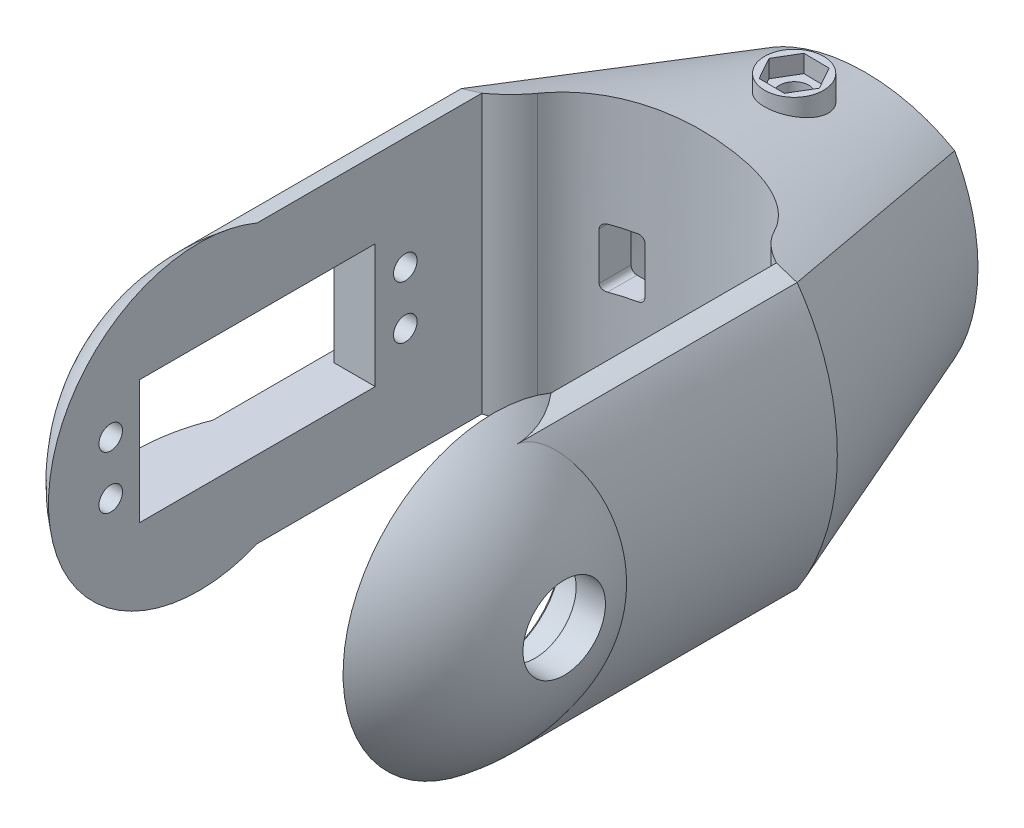
from build123d import *
from build123d.topology import SkipClean

# Parameters (mm, degrees)
BOSS_EXTRUDE3_DEPTH      = 48
CUT_EXTRUDE2_DEPTH       = 54
CUT_EXTRUDE2_DEPTH_BACK  = 57
SKETCH8_W                = 54
SKETCH8_H                = 21
CUT_EXTRUDE4_DEPTH       = 8
SKETCH24_W               = 40
SKETCH24_H               = 21
CUT_EXTRUDE13_DEPTH      = 32
BOSS_EXTRUDE4_DEPTH      = 25
BOSS_EXTRUDE4_DEPTH_BACK = 23
SKETCH21_R               = 5
CUT_EXTRUDE14_DEPTH      = 3
SKETCH26_R               = 2.5
CUT_EXTRUDE15_DEPTH      = 76
SKETCH20_R               = 15.5
CUT_EXTRUDE10_DEPTH      = 25
SKETCH22_W               = 6
SKETCH22_H               = 10
CUT_EXTRUDE12_DEPTH      = 6
FILLET1_R                = 10
CHAMFER1_SIZE            = 0.5
SKETCH27_R               = 2
CUT_EXTRUDE16_DEPTH      = 10
FILLET2_R                = 1


with BuildPart() as part:
    # Sketch1 → Loft3 section 0
    with BuildSketch(Plane.XY.offset(-10)):
        with BuildLine():
            add(Edge.make_bspline(
                [(15.25, 15.25), (6.016026936, 20.560624739), (-6.021103325, 20.458049518), (-15.25, 15.25)],
                knots=[0, 0, 0, 0, 1, 1, 1, 1], degree=3))
            add(Edge.make_bspline(
                [(-15.25, 15.25), (-20.533097965, 5.989438002), (-20.516753713, -5.985540043), (-15.25, -15.25)],
                knots=[0, 0, 0, 0, 1, 1, 1, 1], degree=3))
            add(Edge.make_bspline(
                [(15.25, -15.25), (6.016026936, -20.560624739), (-6.021103325, -20.458049518), (-15.25, -15.25)],
                knots=[0, 0, 0, 0, 1, 1, 1, 1], degree=3))
            add(Edge.make_bspline(
                [(15.25, 15.25), (20.533097965, 5.989438002), (20.516753713, -5.985540043), (15.25, -15.25)],
                knots=[0, 0, 0, 0, 1, 1, 1, 1], degree=3))
        make_face()
    # Sketch2 → Loft3 section 1
    with BuildSketch(Plane.XY.offset(30)):
        with BuildLine():
            add(Edge.make_bspline(
                [(28.5, -22.5), (10.422082605, -28.822679049), (-10.353176496, -28.500649241), (-28.5, -22.5)],
                knots=[0, 0, 0, 0, 1, 1, 1, 1], degree=3))
            add(Edge.make_bspline(
                [(-28.5, -22.5), (-37.136110342, -9.277369886), (-38.061781517, 9.268802559), (-28.5, 22.5)],
                knots=[0, 0, 0, 0, 1, 1, 1, 1], degree=3))
            add(Edge.make_bspline(
                [(28.5, 22.5), (10.422082605, 28.822679049), (-10.353176496, 28.500649241), (-28.5, 22.5)],
                knots=[0, 0, 0, 0, 1, 1, 1, 1], degree=3))
            add(Edge.make_bspline(
                [(28.5, -22.5), (37.136110342, -9.277369886), (38.061781517, 9.268802559), (28.5, 22.5)],
                knots=[0, 0, 0, 0, 1, 1, 1, 1], degree=3))
        make_face()
    loft()

    # Sketch2<4> → Boss-Extrude3 (add)
    with BuildSketch(Plane.XY.offset(30)):
        with BuildLine():
            add(Edge.make_bspline(
                [(28.5, -22.5), (10.422082605, -28.822679049), (-10.353176496, -28.500649241), (-28.5, -22.5)],
                knots=[0, 0, 0, 0, 1, 1, 1, 1], degree=3))
            add(Edge.make_bspline(
                [(-28.5, -22.5), (-37.136110342, -9.277369886), (-38.061781517, 9.268802559), (-28.5, 22.5)],
                knots=[0, 0, 0, 0, 1, 1, 1, 1], degree=3))
            add(Edge.make_bspline(
                [(28.5, 22.5), (10.422082605, 28.822679049), (-10.353176496, 28.500649241), (-28.5, 22.5)],
                knots=[0, 0, 0, 0, 1, 1, 1, 1], degree=3))
            add(Edge.make_bspline(
                [(28.5, -22.5), (37.136110342, -9.277369886), (38.061781517, 9.268802559), (28.5, 22.5)],
                knots=[0, 0, 0, 0, 1, 1, 1, 1], degree=3))
        make_face()
    extrude(amount=BOSS_EXTRUDE3_DEPTH)

    # Sketch6 → Revolve2 (revolve)
    with BuildSketch(Plane(origin=(0, 0, 0), x_dir=(1, 0, 0), z_dir=(0, 1, 0)), mode=Mode.PRIVATE) as revolve2_sk:
        with BuildLine():
            Line((-37.75, -78), (37.75, -78))
            ThreePointArc((37.75, -78), (28.377416998, -100.627416998), (5.75, -110))
            Line((5.75, -110), (-5.75, -110))
            ThreePointArc((-5.75, -110), (-28.377416998, -100.627416998), (-37.75, -78))
        make_face()
    revolve(revolve2_sk.sketch.rotate(Axis((-37.75, 0, 78), (1, 0, 0)), 180), axis=Axis((-37.75, 0, 78), (1, 0, 0)))

    # Sketch5 → Cut-Extrude2 (cut, two sides: drawn at the far end of the back side and taken through both)
    with BuildSketch(Plane(origin=(0, 0, 0), x_dir=(1, 0, 0), z_dir=(0, 1, 0)).offset(-CUT_EXTRUDE2_DEPTH_BACK)):
        with BuildLine():
            add(Edge.make_bspline(
                [(-21.5, -30), (-20.960733822, -25.817648895), (-17.137664225, -20.126916343), (-7.129529987, -18.170322639), (-1.631736919, -17.949617158), (0, -17.954481904)],
                knots=[0, 0, 0, 0, 0.183275792, 0.396096487, 0.487394954, 0.487394954, 0.487394954, 0.487394954], degree=3))
            Line((-21.5, -30), (-25, -30))
            Line((-25, -30), (-25, -121.923002988))
            Line((-25, -121.923002988), (25, -121.923002988))
            Line((25, -121.923002988), (25, -30))
            Line((25, -30), (21.5, -30))
            add(Edge.make_bspline(
                [(0, -17.954481904), (1.668937403, -17.959457557), (7.264316115, -18.228745303), (16.921403056, -19.671171349), (21.504768166, -26.768100937), (21.5, -30)],
                knots=[0.487394954, 0.487394954, 0.487394954, 0.487394954, 0.580774851, 0.804186107, 1, 1, 1, 1], degree=3))
        make_face()
    extrude(amount=CUT_EXTRUDE2_DEPTH + CUT_EXTRUDE2_DEPTH_BACK, mode=Mode.SUBTRACT)

    # Sketch8 → Cut-Extrude4 (cut)
    with BuildSketch(Plane(origin=(-40, 0, 0), x_dir=(0, 0, -1), z_dir=(1, 0, 0))):
        with Locations((-68, 0)):
            Rectangle(SKETCH8_W, SKETCH8_H)
    extrude(amount=CUT_EXTRUDE4_DEPTH, mode=Mode.SUBTRACT)

    # Sketch24 → Cut-Extrude13 (cut)
    with BuildSketch(Plane.ZY.offset(32)):
        with Locations((68.1, 0)):
            Rectangle(SKETCH24_W, SKETCH24_H)
    extrude(amount=-CUT_EXTRUDE13_DEPTH, mode=Mode.SUBTRACT)

    # Sketch21 → Boss-Extrude4 (add, two sides: drawn at the far end of the back side and taken through both)
    with BuildSketch(Plane(origin=(0, 0, 0), x_dir=(1, 0, 0), z_dir=(0, 1, 0)).offset(-BOSS_EXTRUDE4_DEPTH_BACK)):
        with Locations(Location((0, -2, 0), (0, 0, 270))):
            Circle(SKETCH21_R)
    extrude(amount=BOSS_EXTRUDE4_DEPTH + BOSS_EXTRUDE4_DEPTH_BACK)

    # Sketch25 → Cut-Extrude14 (cut)
    with BuildSketch(Plane(origin=(0, 25, 0), x_dir=(1, 0, 0), z_dir=(0, 1, 0))):
        Polygon((-2.120680215, 1.775276867), (-4.329825781, -1.948924506), (-2.209145566, -5.724201373), (2.120680215, -5.775276867), (4.329825781, -2.051075494), (2.209145566, 1.724201373), align=None)
    extrude(amount=-CUT_EXTRUDE14_DEPTH, mode=Mode.SUBTRACT)

    # Sketch26 → Cut-Extrude15 (cut)
    with BuildSketch(Plane(origin=(0, 22, 0), x_dir=(1, 0, 0), z_dir=(0, 1, 0))):
        with Locations(Location((0, -2, 0), (0, 0, 270))):
            Circle(SKETCH26_R)
    extrude(amount=-CUT_EXTRUDE15_DEPTH, mode=Mode.SUBTRACT)

    # Sketch20 → Cut-Extrude10 (cut)
    with BuildSketch(Plane(origin=(0, 0, -10), x_dir=(-1, 0, 0), z_dir=(0, 0, -1))):
        Circle(SKETCH20_R)
    extrude(amount=-CUT_EXTRUDE10_DEPTH, mode=Mode.SUBTRACT)

    # Sketch22 → Cut-Extrude12 (cut)
    with BuildSketch(Plane(origin=(0, 0, 15), x_dir=(-1, 0, 0), z_dir=(0, 0, -1))):
        with Locations((-11.671400751, 0)):
            Rectangle(SKETCH22_W, SKETCH22_H)
        with Locations((11.671400751, 0)):
            Rectangle(SKETCH22_W, SKETCH22_H)
    extrude(amount=-CUT_EXTRUDE12_DEPTH, mode=Mode.SUBTRACT)

    # Sketch23 → Cut-Revolve1 (revolve, cut)
    with BuildSketch(Plane.XY.offset(78), mode=Mode.PRIVATE) as cut_revolve1_sk:
        Polygon((21.5, 0), (43.849477345, 0), (43.849477345, 7), (32, 7), (32, 11), (25, 11), (25, 5), (-37.542166001, 5), (-37.542166001, 0), align=None)
    revolve(cut_revolve1_sk.sketch.rotate(Axis((21.5, 0, 78), (1, 0, 0)), 180), axis=Axis((21.5, 0, 78), (1, 0, 0)), mode=Mode.SUBTRACT)

    # Fillet1
    # the kernel refuses this fillet: 10 mm, written as the material it takes off along each edge
    with BuildSketch(Plane(origin=(-21.5, 0, 30), x_dir=(-1, 0, 0), z_dir=(0, -1, 0))) as fillet1_piece_1:
        with BuildLine():
            CenterArc((7.549511061, 9.143383409), FILLET1_R, 207.239286374, 38.872650389)
            Line((-1.341516368, 4.566306694), (-1.519336916, 4.474765159))
            ThreePointArc((-1.519336916, 4.474765159), (-0.66413073, 2.285040412), (-0.198357932, -0.025575979))
            Line((-0.198357932, -0.025575979), (0, -0.2))
            ThreePointArc((0, -0.2), (1.75, -0.2), (3.419009779, -0.182867668))
            Line((3.419009779, -0.182867668), (3.5, 0))
        make_face()
    extrude(amount=36.400383608, mode=Mode.SUBTRACT)
    with BuildSketch(Plane(origin=(21.5, 0, 30), x_dir=(-0.2651126795336361, 0, -0.9642174376926066), z_dir=(0, 1, 0))) as fillet1_piece_2:
        with BuildLine():
            CenterArc((6.79107998, -9.732231823), FILLET1_R, 103.288959853, 37.235624172)
            Line((-0.927894378, -3.374761032), (-1.082273866, -3.247611616))
            ThreePointArc((-1.082273866, -3.247611616), (-0.656790677, -1.63435798), (-0.192843488, 0.053022536))
            Line((-0.192843488, 0.053022536), (0.053306989, 0.192765051))
            ThreePointArc((0.053306989, 0.192765051), (2.247043889, -0.081654809), (4.446485396, 0.194644636))
            Line((4.446485396, 0.194644636), (4.492457839, 0))
        make_face()
    extrude(amount=35.818730293, mode=Mode.SUBTRACT)
    with BuildSketch(Plane(origin=(21.5, 0, 30), x_dir=(1, 0, 0), z_dir=(0, -1, 0))) as fillet1_piece_3:
        with BuildLine():
            CenterArc((7.583586221, -9.128215794), FILLET1_R, 114.101767636, 37.235624172)
            Line((-1.191007535, -4.331706186), (-1.366499411, -4.235775994))
            ThreePointArc((-1.366499411, -4.235775994), (-0.516986836, -2.188286626), (-0.199999782, -0.000295069))
            Line((-0.199999782, -0.000295069), (0, 0.2))
            ThreePointArc((0, 0.2), (1.75, 0.2), (3.418328276, 0.182564316))
            Line((3.418328276, 0.182564316), (3.5, 0))
        make_face()
    extrude(amount=35.818730293, mode=Mode.SUBTRACT)
    with BuildSketch(Plane(origin=(-21.5, 0, 30), x_dir=(-1, 0, 0), z_dir=(0, 1, 0))) as fillet1_piece_4:
        with BuildLine():
            CenterArc((7.549511061, -9.143383409), FILLET1_R, 113.888063237, 38.872650389)
            Line((-1.341516368, -4.566306694), (-1.519336916, -4.474765159))
            ThreePointArc((-1.519336916, -4.474765159), (-0.66413073, -2.285040412), (-0.198357932, 0.025575979))
            Line((-0.198357932, 0.025575979), (0, 0.2))
            ThreePointArc((0, 0.2), (1.75, 0.2), (3.419009779, 0.182867668))
            Line((3.419009779, 0.182867668), (3.5, 0))
        make_face()
    extrude(amount=36.400383608, mode=Mode.SUBTRACT)

    # Chamfer1
    chamfer1_edges = [part.edges().sort_by_distance(p)[0] for p in [
        (25, 11, 78),
    ]]
    chamfer(chamfer1_edges, length=CHAMFER1_SIZE)

    # Sketch27 → Cut-Extrude16 (cut)
    with SkipClean():  # the faces are left unmerged after this step: merging them gives an invalid solid
        with BuildSketch(Plane.ZY.offset(32)):
            with Locations(Location((43, 4.5, 0), (0, 0, 180))):
                Circle(SKETCH27_R)
            with Locations(Location((43, -4.5, 0), (0, 0, 180))):
                Circle(SKETCH27_R)
            with Locations((93, 4.5)):
                Circle(SKETCH27_R)
            with Locations((93, -4.5)):
                Circle(SKETCH27_R)
        extrude(amount=-CUT_EXTRUDE16_DEPTH, mode=Mode.SUBTRACT)

    # Fillet2
    fillet2_edges = [part.edges().sort_by_distance(p)[0] for p in [
        (-8.671400751, 5, 16.826763972),
        (-8.671400751, -5, 16.826763972),
        (8.671400751, 5, 16.792463848),
        (8.671400751, -5, 16.792463848),
        (-14.671400751, -5, 17.713120589),
        (-14.671400751, 5, 17.713120589),
        (14.671400751, 5, 17.673971957),
        (14.671400751, -5, 17.673971957),
    ]]
    fillet(fillet2_edges, radius=FILLET2_R)


solid = part.part
